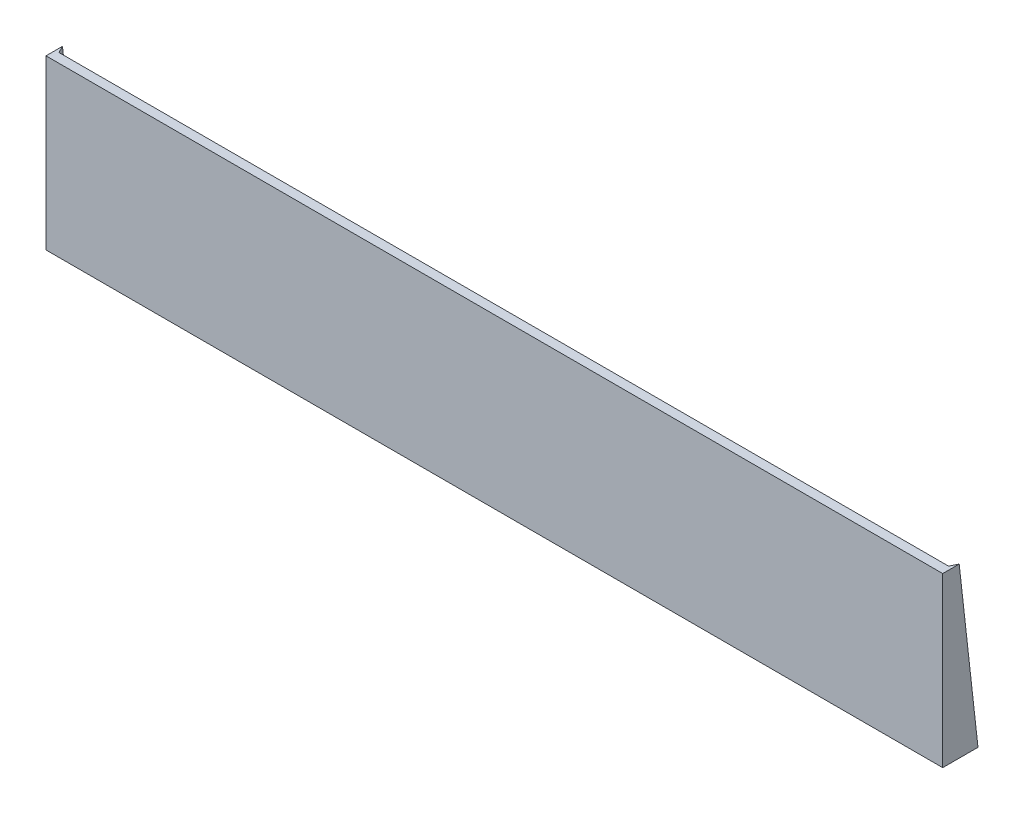
from build123d import *

# Parameters (mm, degrees)
BOSS_EXTRUDE1_DEPTH = 22.86
CHAMFER1_SIZE       = 25.4
CHAMFER1_SIZE_2     = 1.27


with BuildPart() as part:
    # Sketch2 → Boss-Extrude1 (new body)
    with BuildSketch(Plane(origin=(0, 0, 0), x_dir=(1, 0, 0), z_dir=(0, 1, 0))):
        Polygon((-60.96, 5.08), (-59.69, 2.54), (59.69, 2.54), (60.96, 5.08), (60.96, 0), (-60.96, 0), align=None)
    extrude(amount=BOSS_EXTRUDE1_DEPTH)

    # Chamfer1
    # the kernel refuses this chamfer: 25.4, 1.27 mm, written as the material it takes off along each edge
    with BuildSketch(Plane(origin=(-90.492623078, 22.86, -64.145246157), x_dir=(0, -1, 0), z_dir=(0.44721359549995887, 0, 0.8944271909999155))) as chamfer1_piece_1_section:
        Polygon((CHAMFER1_SIZE, 0), (0, -CHAMFER1_SIZE_2), (0, 0), align=None)
    chamfer1_piece_1 = extrude(amount=134.913711846, mode=Mode.PRIVATE)
    chamfer1_piece_1 = split(chamfer1_piece_1, bisect_by=Plane(origin=(-90.492623078, 22.86, -2.54), z_dir=(0, 0, -1)), keep=Keep.TOP, mode=Mode.PRIVATE)
    add(chamfer1_piece_1, mode=Mode.SUBTRACT)
    with BuildSketch(Plane(origin=(-125.726952757, 22.86, -2.54), x_dir=(0, -1, 0), z_dir=(1, 0, 0))) as chamfer1_piece_2_section:
        Polygon((CHAMFER1_SIZE, 0), (0, -CHAMFER1_SIZE_2), (0, 0), align=None)
    chamfer1_piece_2 = extrude(amount=251.453905515, mode=Mode.PRIVATE)
    chamfer1_piece_2 = split(chamfer1_piece_2, bisect_by=Plane(origin=(-72.897390551, 22.86, -28.954781103), z_dir=(0.8944271909999155, 0, -0.44721359549995887)), keep=Keep.TOP, mode=Mode.PRIVATE)
    chamfer1_piece_2 = split(chamfer1_piece_2, bisect_by=Plane(origin=(22.606609449, 22.86, 71.626781103), z_dir=(-0.8944271909999155, 0, -0.44721359549995887)), keep=Keep.TOP, mode=Mode.PRIVATE)
    add(chamfer1_piece_2, mode=Mode.SUBTRACT)
    with BuildSketch(Plane(origin=(30.157376922, 22.86, 56.525246157), x_dir=(0, -1, 0), z_dir=(0.44721359549995887, 0, -0.8944271909999155))) as chamfer1_piece_3_section:
        Polygon((CHAMFER1_SIZE, 0), (0, -CHAMFER1_SIZE_2), (0, 0), align=None)
    chamfer1_piece_3 = extrude(amount=134.913711846, mode=Mode.PRIVATE)
    chamfer1_piece_3 = split(chamfer1_piece_3, bisect_by=Plane(origin=(30.157376922, 22.86, -2.54), z_dir=(0, 0, -1)), keep=Keep.TOP, mode=Mode.PRIVATE)
    add(chamfer1_piece_3, mode=Mode.SUBTRACT)
    with BuildSketch(Plane(origin=(-90.492623078, 22.86, -64.145246157), x_dir=(0, -1, 0), z_dir=(0.44721359549995887, 0, 0.8944271909999155))) as chamfer1_piece_4a_section:
        Polygon((CHAMFER1_SIZE, 0), (0, -CHAMFER1_SIZE_2), (0, 0), align=None)
    chamfer1_piece_4a = extrude(amount=134.913711846, mode=Mode.PRIVATE)
    chamfer1_piece_4a = split(chamfer1_piece_4a, bisect_by=Plane(origin=(-90.492623078, 22.86, -2.54), z_dir=(0, 0, 1)), keep=Keep.TOP, mode=Mode.PRIVATE)
    chamfer1_piece_4a = split(chamfer1_piece_4a, bisect_by=Plane(origin=(-90.492623078, 22.86, 0), z_dir=(0, 0, -1)), keep=Keep.TOP, mode=Mode.PRIVATE)
    chamfer1_piece_4a = split(chamfer1_piece_4a, bisect_by=Plane(origin=(-60.96, 22.86, -64.145246157), z_dir=(1, 0, 0)), keep=Keep.TOP, mode=Mode.PRIVATE)
    chamfer1_piece_4a = split(chamfer1_piece_4a, bisect_by=Plane(origin=(-90.492623078, 0, -64.145246157), z_dir=(0, 1, 0)), keep=Keep.TOP, mode=Mode.PRIVATE)
    with BuildSketch(Plane(origin=(-125.726952757, 22.86, -2.54), x_dir=(0, -1, 0), z_dir=(1, 0, 0))) as chamfer1_piece_4b_section:
        Polygon((CHAMFER1_SIZE, 0), (0, -CHAMFER1_SIZE_2), (0, 0), align=None)
    chamfer1_piece_4b = extrude(amount=251.453905515, mode=Mode.PRIVATE)
    chamfer1_piece_4b = split(chamfer1_piece_4b, bisect_by=Plane(origin=(-72.897390551, 22.86, -28.954781103), z_dir=(-0.8944271909999155, 0, 0.44721359549995887)), keep=Keep.TOP, mode=Mode.PRIVATE)
    chamfer1_piece_4b = split(chamfer1_piece_4b, bisect_by=Plane(origin=(-60.96, 22.86, -2.54), z_dir=(1, 0, 0)), keep=Keep.TOP, mode=Mode.PRIVATE)
    chamfer1_piece_4b = split(chamfer1_piece_4b, bisect_by=Plane(origin=(-125.726952757, 0, -2.54), z_dir=(0, 1, 0)), keep=Keep.TOP, mode=Mode.PRIVATE)
    chamfer1_piece_4 = chamfer1_piece_4a & chamfer1_piece_4b
    add(chamfer1_piece_4, mode=Mode.SUBTRACT)
    with BuildSketch(Plane(origin=(-125.726952757, 22.86, -2.54), x_dir=(0, -1, 0), z_dir=(1, 0, 0))) as chamfer1_piece_5a_section:
        Polygon((CHAMFER1_SIZE, 0), (0, -CHAMFER1_SIZE_2), (0, 0), align=None)
    chamfer1_piece_5a = extrude(amount=251.453905515, mode=Mode.PRIVATE)
    chamfer1_piece_5a = split(chamfer1_piece_5a, bisect_by=Plane(origin=(22.606609449, 22.86, 71.626781103), z_dir=(0.8944271909999155, 0, 0.44721359549995887)), keep=Keep.TOP, mode=Mode.PRIVATE)
    chamfer1_piece_5a = split(chamfer1_piece_5a, bisect_by=Plane(origin=(60.96, 22.86, -2.54), z_dir=(-1, 0, 0)), keep=Keep.TOP, mode=Mode.PRIVATE)
    chamfer1_piece_5a = split(chamfer1_piece_5a, bisect_by=Plane(origin=(-125.726952757, 0, -2.54), z_dir=(0, 1, 0)), keep=Keep.TOP, mode=Mode.PRIVATE)
    with BuildSketch(Plane(origin=(30.157376922, 22.86, 56.525246157), x_dir=(0, -1, 0), z_dir=(0.44721359549995887, 0, -0.8944271909999155))) as chamfer1_piece_5b_section:
        Polygon((CHAMFER1_SIZE, 0), (0, -CHAMFER1_SIZE_2), (0, 0), align=None)
    chamfer1_piece_5b = extrude(amount=134.913711846, mode=Mode.PRIVATE)
    chamfer1_piece_5b = split(chamfer1_piece_5b, bisect_by=Plane(origin=(30.157376922, 22.86, -2.54), z_dir=(0, 0, 1)), keep=Keep.TOP, mode=Mode.PRIVATE)
    chamfer1_piece_5b = split(chamfer1_piece_5b, bisect_by=Plane(origin=(60.96, 22.86, 56.525246157), z_dir=(-1, 0, 0)), keep=Keep.TOP, mode=Mode.PRIVATE)
    chamfer1_piece_5b = split(chamfer1_piece_5b, bisect_by=Plane(origin=(30.157376922, 22.86, 0), z_dir=(0, 0, -1)), keep=Keep.TOP, mode=Mode.PRIVATE)
    chamfer1_piece_5b = split(chamfer1_piece_5b, bisect_by=Plane(origin=(30.157376922, 0, 56.525246157), z_dir=(0, 1, 0)), keep=Keep.TOP, mode=Mode.PRIVATE)
    chamfer1_piece_5 = chamfer1_piece_5a & chamfer1_piece_5b
    add(chamfer1_piece_5, mode=Mode.SUBTRACT)


solid = part.part
